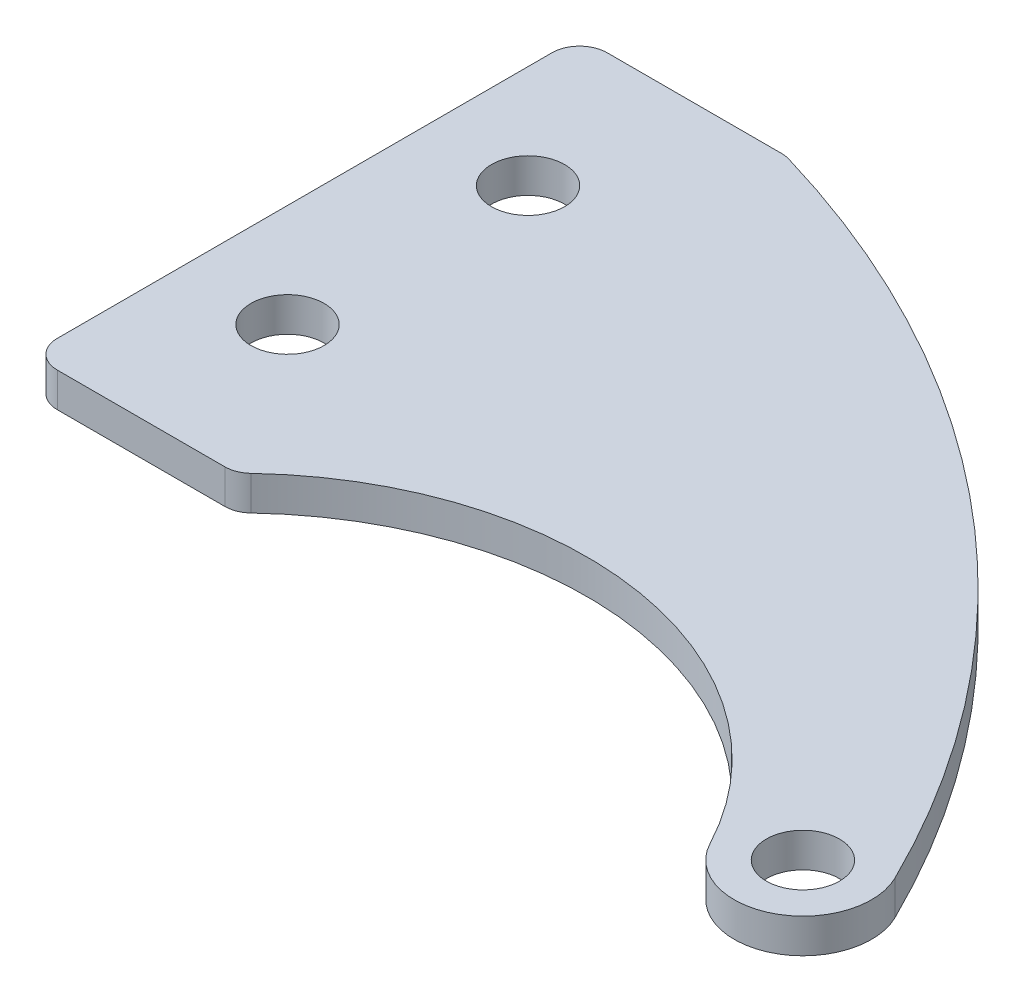
from build123d import *

# Parameters (mm, degrees)
BOSS_EXTRUDE1_DEPTH     = 3.175
F_1_4_CLEARANCE_HOLE2_D = 6.7564
F_1_4_CLEARANCE_HOLE1_D = 6.7564
FILLET1_R               = 2.54


with BuildPart() as part:
    # Sketch1 → Boss-Extrude1 (new body)
    with BuildSketch(Plane(origin=(0, 0, 0), x_dir=(1, 0, 0), z_dir=(0, 1, 0))):
        with BuildLine():
            Line((0, 50.8), (19.05, 50.8))
            ThreePointArc((19.05, 50.8), (56.03836137, 31.046405743), (81.899154962, -1.962119182))
            ThreePointArc((81.899154962, -1.962119182), (79.082321477, -10.420655433), (70.584022136, -7.726162031))
            ThreePointArc((70.584022136, -7.726162031), (46.770595677, 9.16746016), (19.05, 0))
            Line((19.05, 0), (0, 0))
            Line((0, 0), (0, 50.8))
        make_face()
    extrude(amount=BOSS_EXTRUDE1_DEPTH)

    # 1/4 Clearance Hole2 (through all)
    with Locations(Plane(origin=(0, 0, 0), x_dir=(-1, 0, 0), z_dir=(0, -1, 0))):
        with Locations((-76.2, -4.7625)):
            Hole(F_1_4_CLEARANCE_HOLE2_D / 2)

    # 1/4 Clearance Hole1 (through all)
    with Locations(Plane(origin=(0, 3.175, 0), x_dir=(1, 0, 0), z_dir=(0, 1, 0))):
        with Locations((9.525, 36.5125), (9.525, 14.2875)):
            Hole(F_1_4_CLEARANCE_HOLE1_D / 2)

    # Fillet1
    fillet1_edges = [part.edges().sort_by_distance(p)[0] for p in [
        (19.05, 1.5875, 0),
        (0, 1.5875, 0),
        (0, 1.5875, -50.8),
        (19.05, 1.5875, -50.8),
    ]]
    fillet(fillet1_edges, radius=FILLET1_R)


solid = part.part
